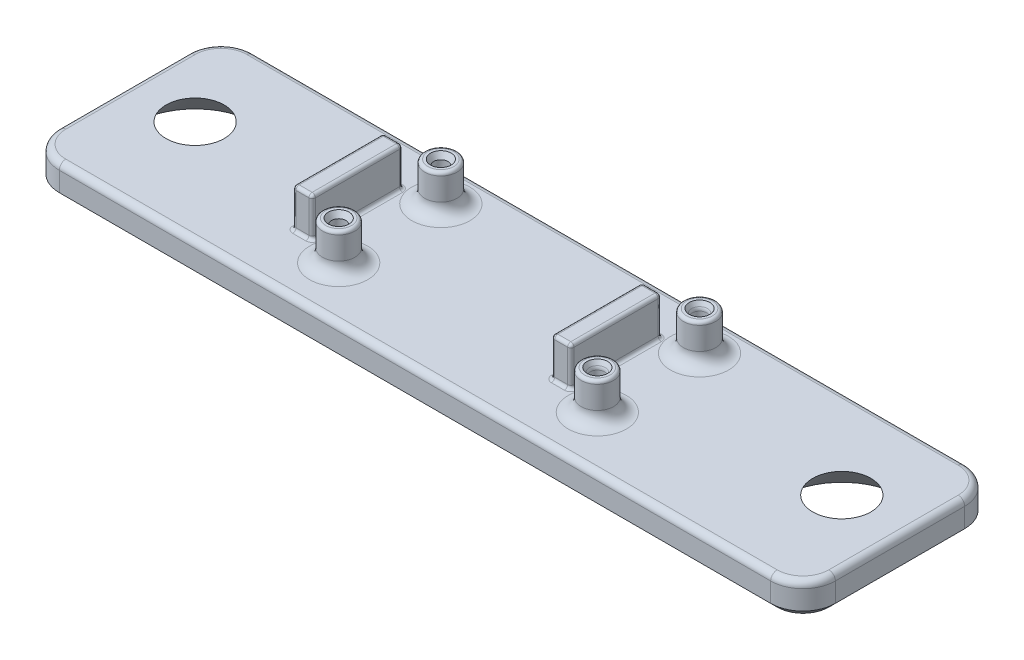
from build123d import *
from OCP.BRepFilletAPI import BRepFilletAPI_MakeChamfer

# Parameters (mm, degrees)
SKETCH_1_W          = 120
SKETCH_1_H          = 30
SKETCH_1_R          = 4.5
EXTRUDE_1_DEPTH     = 5
FILLET_1_R          = 5
SKETCH_2_R          = 2.5
SKETCH_2_R_2        = 1.1
SKETCH_2_W          = 3
SKETCH_2_H          = 14
EXTRUDE_2_DEPTH     = 6
CUT_EXTRUDE_START   = -8
SKETCH_3_R          = 1.1
CUT_EXTRUDE_1_DEPTH = 8
FILLET_2_R          = 2
FILLET_3_R          = 0.5
FILLET_4_R          = 1
CHAMFER_1_SIZE      = 5
CHAMFER_2_SIZE      = 1
CHAMFER_3_SIZE      = 0.5
CHAMFER_3_SIZE2     = 0.866025404
FILLET_5_R          = 1


# Some blends are built 0.0001 mm under size
with BuildPart() as part:
    # Эскиз1 → Бобышка-Вытянуть1 (new body)
    with BuildSketch(Plane(origin=(0, 0, 0), x_dir=(1, 0, 0), z_dir=(0, 1, 0))):
        Rectangle(SKETCH_1_W, SKETCH_1_H)
        with Locations(Location((-50, 1, 0), (0, 0, 270))):
            Circle(SKETCH_1_R, mode=Mode.SUBTRACT)
        with Locations(Location((50, 1, 0), (0, 0, 90))):
            Circle(SKETCH_1_R, mode=Mode.SUBTRACT)
    extrude(amount=EXTRUDE_1_DEPTH)

    # Скругление1
    fillet_1_edges = [part.edges().sort_by_distance(p)[0] for p in [
        (60, 2.5, 15),
        (-60, 2.5, 15),
        (-60, 2.5, -15),
        (60, 2.5, -15),
    ]]
    fillet(fillet_1_edges, radius=FILLET_1_R)

    # Эскиз2 → Бобышка-Вытянуть2 (add)
    # profile 1 of 6: a face of its own
    with BuildSketch(Plane(origin=(0, 5, 0), x_dir=(1, 0, 0), z_dir=(0, 1, 0))):
        with Locations(Location((20, 9, 0), (0, 0, 90))):
            Circle(SKETCH_2_R)
        with Locations(Location((20, 9, 0), (0, 0, 90))):
            Circle(SKETCH_2_R_2, mode=Mode.SUBTRACT)
    # profile 2 of 6: a face of its own
    with BuildSketch(Plane(origin=(0, 5, 0), x_dir=(1, 0, 0), z_dir=(0, 1, 0))):
        with Locations(Location((20, -6.8, 0), (0, 0, 90))):
            Circle(SKETCH_2_R)
        with Locations(Location((20, -6.8, 0), (0, 0, 270))):
            Circle(SKETCH_2_R_2, mode=Mode.SUBTRACT)
    # profile 3 of 6: a face of its own
    with BuildSketch(Plane(origin=(0, 5, 0), x_dir=(1, 0, 0), z_dir=(0, 1, 0))):
        with Locations(Location((-20, 9, 0), (0, 0, 90))):
            Circle(SKETCH_2_R)
        with Locations(Location((-20, 9, 0), (0, 0, 90))):
            Circle(SKETCH_2_R_2, mode=Mode.SUBTRACT)
    # profile 4 of 6: a face of its own
    with BuildSketch(Plane(origin=(0, 5, 0), x_dir=(1, 0, 0), z_dir=(0, 1, 0))):
        with Locations(Location((-20, -6.8, 0), (0, 0, 90))):
            Circle(SKETCH_2_R)
        with Locations(Location((-20, -6.8, 0), (0, 0, 270))):
            Circle(SKETCH_2_R_2, mode=Mode.SUBTRACT)
    # profile 5 of 6: a face of its own
    with BuildSketch(Plane(origin=(0, 5, 0), x_dir=(1, 0, 0), z_dir=(0, 1, 0))):
        with Locations((13.5, 1.1)):
            Rectangle(SKETCH_2_W, SKETCH_2_H)
    # profile 6 of 6: a face of its own
    with BuildSketch(Plane(origin=(0, 5, 0), x_dir=(1, 0, 0), z_dir=(0, 1, 0))):
        with Locations((-26.5, 1.1)):
            Rectangle(SKETCH_2_W, SKETCH_2_H)
    extrude(amount=EXTRUDE_2_DEPTH)

    # Эскиз3 → Cut-Extrude 1 (cut)
    with BuildSketch(Plane(origin=(0, 11, 0), x_dir=(1, 0, 0), z_dir=(0, 1, 0)).offset(CUT_EXTRUDE_START)):
        with Locations(Location((20, -6.8, 0), (0, 0, 270))):
            Circle(SKETCH_3_R)
        with Locations(Location((20, 9, 0), (0, 0, 90))):
            Circle(SKETCH_3_R)
    extrude(amount=CUT_EXTRUDE_1_DEPTH, mode=Mode.SUBTRACT)

    # Скругление2
    fillet_2_edges = [part.edges().sort_by_distance(p)[0] for p in [
        (20, 5, -6.5),
        (20, 5, 9.3),
        (-20, 5, -6.5),
        (-20, 5, 9.3),
    ]]
    fillet(fillet_2_edges, radius=FILLET_2_R)

    # Скругление3
    fillet_3_edges = [part.edges().sort_by_distance(p)[0] for p in [
        (20, 11, -6.5),
        (20, 11, 9.3),
        (13.5, 5, -8.1),
        (15, 8, -8.1),
        (12, 5, -1.1),
        (12, 8, -8.1),
        (13.5, 5, 5.9),
        (12, 8, 5.9),
        (15, 5, -1.1),
        (15, 8, 5.9),
        (13.5, 11, -8.1),
        (12, 11, -1.1),
        (13.5, 11, 5.9),
        (15, 11, -1.1),
        (-20, 11, -6.5),
        (-20, 11, 9.3),
        (-26.5, 5, -8.1),
        (-25, 8, -8.1),
        (-28, 5, -1.1),
        (-28, 8, -8.1),
        (-26.5, 5, 5.9),
        (-28, 8, 5.9),
        (-25, 5, -1.1),
        (-25, 8, 5.9),
        (-26.5, 11, -8.1),
        (-28, 11, -1.1),
        (-26.5, 11, 5.9),
        (-25, 11, -1.1),
    ]]
    fillet(fillet_3_edges, radius=FILLET_3_R)

    # Скругление4
    fillet_4_edges = [part.edges().sort_by_distance(p)[0] for p in [
        (-60, 5, 0),
        (0, 5, -15),
        (60, 5, 0),
        (0, 5, 15),
        (58.535533906, 5, 13.535533906),
        (58.535533906, 5, -13.535533906),
        (-58.535533906, 5, 13.535533906),
        (-58.535533906, 5, -13.535533906),
    ]]
    fillet(fillet_4_edges, radius=FILLET_4_R)

    # Фаска1
    chamfer_1_edges = [part.edges().sort_by_distance(p)[0] for p in [
        (-50, 0, -5.5),
        (50, 0, 3.5),
    ]]
    chamfer(chamfer_1_edges, length=CHAMFER_1_SIZE - 0.0001)  # a hair under: the kernel refuses the full size

    # Фаска2
    # the kernel refuses this chamfer: 1 mm, written as the material it takes off along each edge
    with BuildSketch(Plane(origin=(-60, 0, -10), x_dir=(0.9996219169112968, -0.027495876610586292, 0), z_dir=(0, 0, 1)), Plane(origin=(60, 0, 10), x_dir=(-0.9996219169112968, -0.027495876610586292, 0), z_dir=(0, 0, -1))) as chamfer_2_piece_1:
        Polygon((CHAMFER_2_SIZE * 0.999621916911, CHAMFER_2_SIZE * 0.0274958766106), (-CHAMFER_2_SIZE * 0.0274958766106, CHAMFER_2_SIZE * 0.999621916911), (0, 0), align=None)
    extrude(amount=20, mode=Mode.SUBTRACT)
    with BuildSketch(Plane(origin=(-55, 0, 15), x_dir=(0, -0.02749587661058639, -0.9996219169112968), z_dir=(1, 0, 0)), Plane(origin=(55, 0, -15), x_dir=(0, -0.02749587661058639, 0.9996219169112968), z_dir=(-1, 0, 0))) as chamfer_2_piece_2:
        Polygon((CHAMFER_2_SIZE * 0.999621916911, CHAMFER_2_SIZE * 0.0274958766106), (-CHAMFER_2_SIZE * 0.0274958766106, CHAMFER_2_SIZE * 0.999621916911), (0, 0), align=None)
    extrude(amount=110, mode=Mode.SUBTRACT)
    with BuildSketch(Plane(origin=(55, 0, 10), x_dir=(0, 0, 1), z_dir=(-1, 0, 0))) as chamfer_2_piece_3:
        Polygon((5 - CHAMFER_2_SIZE, 0), (5, CHAMFER_2_SIZE), (5, 0), align=None)
    revolve(axis=Axis((55, 0, 10), (0, 1, 0)), revolution_arc=90, mode=Mode.SUBTRACT)
    with BuildSketch(Plane(origin=(55, 0, -10), x_dir=(1, 0, 0), z_dir=(0, 0, 1))) as chamfer_2_piece_4:
        Polygon((5 - CHAMFER_2_SIZE, 0), (5, CHAMFER_2_SIZE), (5, 0), align=None)
    revolve(axis=Axis((55, 0, -10), (0, 1, 0)), revolution_arc=90, mode=Mode.SUBTRACT)
    with BuildSketch(Plane(origin=(-55, 0, 10), x_dir=(0, 0, 1), z_dir=(1, 0, 0))) as chamfer_2_piece_5:
        Polygon((5 - CHAMFER_2_SIZE, 0), (5, -CHAMFER_2_SIZE), (5, 0), align=None)
    revolve(axis=Axis((-55, 0, 10), (0, -1, 0)), revolution_arc=90, mode=Mode.SUBTRACT)
    with BuildSketch(Plane(origin=(-55, 0, -10), x_dir=(0, 0, -1), z_dir=(1, 0, 0))) as chamfer_2_piece_6:
        Polygon((5 - CHAMFER_2_SIZE, 0), (5, CHAMFER_2_SIZE), (5, 0), align=None)
    revolve(axis=Axis((-55, 0, -10), (0, 1, 0)), revolution_arc=90, mode=Mode.SUBTRACT)

    # Фаска3: one chamfer whose edges measure the first distance from different faces: ONE call of the kernel's chamfer builder (chamfer() names one face for all edges)
    chamfer_3_edges_1 = [part.edges().sort_by_distance(p)[0] for p in [
        (20, 11, -7.9),
    ]]
    chamfer_3_side_1 = [part.faces().sort_by_distance(p)[0] for p in [
        (20, 11, -7.056568542),
    ]]
    chamfer_3_edges_2 = [part.edges().sort_by_distance(p)[0] for p in [
        (20, 11, 5.7),
    ]]
    chamfer_3_side_2 = [part.faces().sort_by_distance(p)[0] for p in [
        (20, 11, 8.743431458),
    ]]
    chamfer_3_edges_3 = [part.edges().sort_by_distance(p)[0] for p in [
        (-20, 11, -7.9),
    ]]
    chamfer_3_side_3 = [part.faces().sort_by_distance(p)[0] for p in [
        (-20, 11, -7.056568542),
    ]]
    chamfer_3_edges_4 = [part.edges().sort_by_distance(p)[0] for p in [
        (-20, 11, 5.7),
    ]]
    chamfer_3_side_4 = [part.faces().sort_by_distance(p)[0] for p in [
        (-20, 11, 8.743431458),
    ]]
    chamfer_3 = BRepFilletAPI_MakeChamfer(part.part.solid().wrapped)
    for e in chamfer_3_edges_1:
        chamfer_3.Add(CHAMFER_3_SIZE, CHAMFER_3_SIZE2, e.wrapped, chamfer_3_side_1[0].wrapped)  # the first distance lies on this face
    for e in chamfer_3_edges_2:
        chamfer_3.Add(CHAMFER_3_SIZE, CHAMFER_3_SIZE2, e.wrapped, chamfer_3_side_2[0].wrapped)  # the first distance lies on this face
    for e in chamfer_3_edges_3:
        chamfer_3.Add(CHAMFER_3_SIZE, CHAMFER_3_SIZE2, e.wrapped, chamfer_3_side_3[0].wrapped)  # the first distance lies on this face
    for e in chamfer_3_edges_4:
        chamfer_3.Add(CHAMFER_3_SIZE, CHAMFER_3_SIZE2, e.wrapped, chamfer_3_side_4[0].wrapped)  # the first distance lies on this face
    add(Compound.cast(chamfer_3.Shape()), mode=Mode.REPLACE)

    # Скругление5
    fillet_5_edges = [part.edges().sort_by_distance(p)[0] for p in [
        (20, 10.133974596, 5.7),
        (20, 10.133974596, -7.9),
    ]]
    fillet(fillet_5_edges, radius=FILLET_5_R)


solid = part.part
